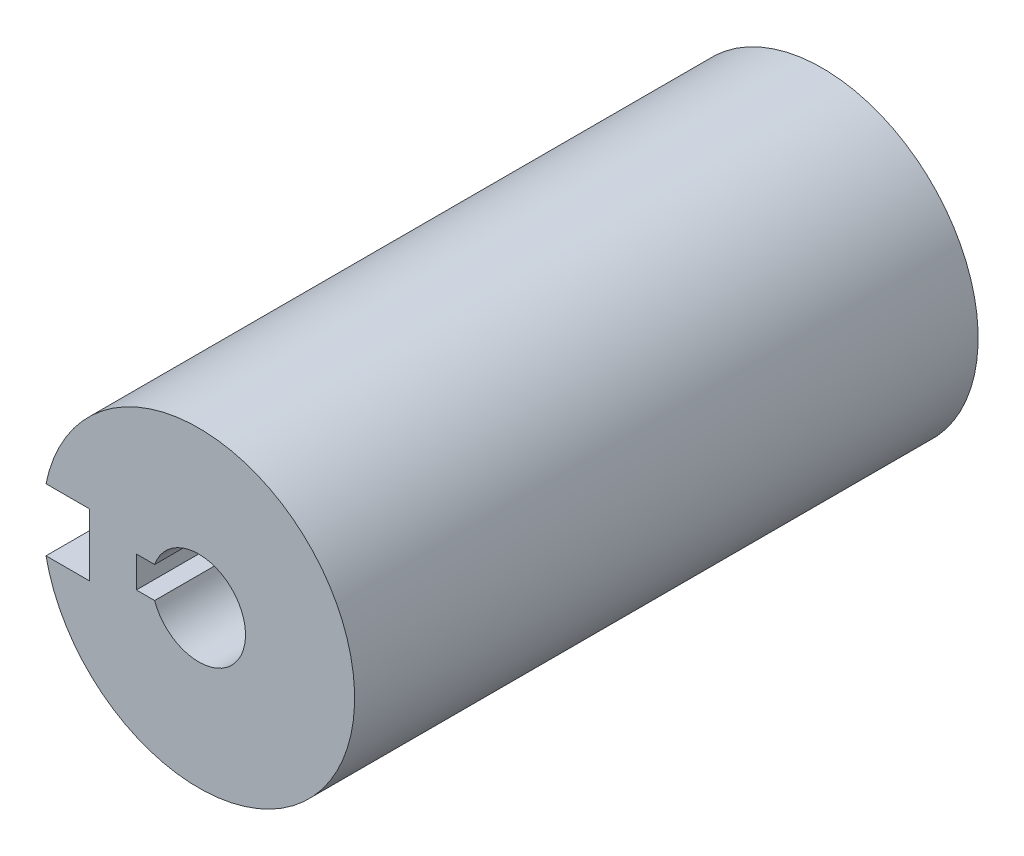
from build123d import *

# Parameters (mm, degrees)
SKETCH5_R           = 5
SKETCH5_R_2         = 1.5
BOSS_EXTRUDE2_DEPTH = 20
SKETCH6_W           = 1
SKETCH6_H           = 1
CUT_EXTRUDE4_DEPTH  = 12
SKETCH7_W           = 1
SKETCH7_H           = 1
CUT_EXTRUDE6_DEPTH  = 4
SKETCH8_W           = 3
SKETCH8_H           = 2
CUT_EXTRUDE7_DEPTH  = 20


with BuildPart() as part:
    # Sketch5 → Boss-Extrude2 (new body)
    with BuildSketch(Plane.XY):
        Circle(SKETCH5_R)
        Circle(SKETCH5_R_2, mode=Mode.SUBTRACT)
    extrude(amount=BOSS_EXTRUDE2_DEPTH)

    # Sketch6 → Cut-Extrude4 (cut)
    with BuildSketch(Plane.XY.offset(20)):
        with Locations((-1.5, 0)):
            Rectangle(SKETCH6_W, SKETCH6_H)
    extrude(amount=-CUT_EXTRUDE4_DEPTH, mode=Mode.SUBTRACT)

    # Sketch7 → Cut-Extrude6 (cut)
    with BuildSketch(Plane.XY.offset(20)):
        with Locations((-5, 0)):
            Rectangle(SKETCH7_W, SKETCH7_H)
    extrude(amount=-CUT_EXTRUDE6_DEPTH, mode=Mode.SUBTRACT)

    # Sketch8 → Cut-Extrude7 (cut)
    with BuildSketch(Plane(origin=(0, 0, 0), x_dir=(-1, 0, 0), z_dir=(0, 0, -1))):
        with Locations((5, 0)):
            Rectangle(SKETCH8_W, SKETCH8_H)
    extrude(amount=-CUT_EXTRUDE7_DEPTH, mode=Mode.SUBTRACT)


solid = part.part
